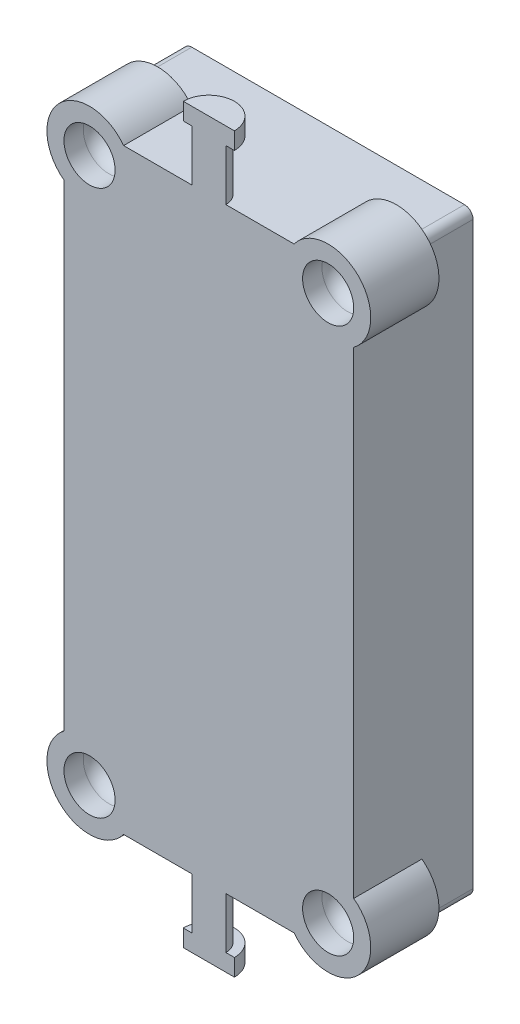
from build123d import *

# Parameters (mm, degrees)
SKETCH1_W           = 34
SKETCH1_H           = 70
BOSS_EXTRUDE1_DEPTH = 14
SKETCH2_W           = 30
SKETCH2_H           = 66
CUT_EXTRUDE1_DEPTH  = 12
SKETCH3_R           = 3
BOSS_EXTRUDE2_DEPTH = 12
SKETCH4_R           = 2
CUT_EXTRUDE2_DEPTH  = 80.069589603
CUT_EXTRUDE4_REACH  = 81.07
SKETCH6_R           = 2.5
SKETCH6_R_2         = 2
FILLET1_R           = 1
BOSS_EXTRUDE3_START = -8
SKETCH7_R           = 5
SKETCH7_R_2         = 3
BOSS_EXTRUDE3_DEPTH = 8
CUT_EXTRUDE7_START  = -4
SKETCH8_R           = 3
CUT_EXTRUDE7_DEPTH  = 4
BOSS_EXTRUDE4_DEPTH = 8
CUT_EXTRUDE8_START  = -8
CUT_EXTRUDE8_DEPTH  = 6
BOSS_EXTRUDE5_START = 8
BOSS_EXTRUDE5_DEPTH = 8
CUT_EXTRUDE9_START  = -2
CUT_EXTRUDE9_DEPTH  = 6
FILLET3_R           = 2


with BuildPart() as part:
    # Sketch1 → Boss-Extrude1 (new body)
    with BuildSketch(Plane.XY):
        with Locations((17, 35)):
            Rectangle(SKETCH1_W, SKETCH1_H)
    extrude(amount=BOSS_EXTRUDE1_DEPTH)

    # Sketch2 → Cut-Extrude1 (cut)
    with BuildSketch(Plane(origin=(0, 0, 0), x_dir=(-1, 0, 0), z_dir=(0, 0, -1))):
        with Locations((-17, 35)):
            Rectangle(SKETCH2_W, SKETCH2_H)
    extrude(amount=-CUT_EXTRUDE1_DEPTH, mode=Mode.SUBTRACT)

    # Sketch3 → Boss-Extrude2 (add)
    with BuildSketch(Plane(origin=(0, 0, 0), x_dir=(-1, 0, 0), z_dir=(0, 0, -1))):
        with Locations((-31, 67)):
            Circle(SKETCH3_R)
        with Locations((-3, 67)):
            Circle(SKETCH3_R)
        with Locations((-3, 3)):
            Circle(SKETCH3_R)
        with Locations((-31, 3)):
            Circle(SKETCH3_R)
    extrude(amount=-BOSS_EXTRUDE2_DEPTH)

    # Sketch4 → Cut-Extrude2 (cut, through all)
    with BuildSketch(Plane(origin=(0, 0, 0), x_dir=(-1, 0, 0), z_dir=(0, 0, -1))):
        with Locations((-3, 67)):
            Circle(SKETCH4_R)
        with Locations((-31, 67)):
            Circle(SKETCH4_R)
        with Locations((-3, 3)):
            Circle(SKETCH4_R)
        with Locations((-31, 3)):
            Circle(SKETCH4_R)
    extrude(amount=-CUT_EXTRUDE2_DEPTH, mode=Mode.SUBTRACT)

    # Sketch6 → Cut-Extrude4 (cut, up to next)
    with BuildSketch(Plane.XZ, mode=Mode.PRIVATE) as cut_extrude4_sk1:
        with Locations((9.5, 0)):
            Circle(SKETCH6_R)
    cut_extrude4_tool1 = extrude(cut_extrude4_sk1.sketch, amount=-CUT_EXTRUDE4_REACH, mode=Mode.PRIVATE) & part.part
    # Sketch6 → Cut-Extrude4 (cut, up to next)
    with BuildSketch(Plane.XZ, mode=Mode.PRIVATE) as cut_extrude4_sk2:
        with Locations((24.5, 0)):
            Circle(SKETCH6_R_2)
    cut_extrude4_tool2 = extrude(cut_extrude4_sk2.sketch, amount=-CUT_EXTRUDE4_REACH, mode=Mode.PRIVATE) & part.part
    add(cut_extrude4_tool1.solids().sort_by_distance((9.5, 0, 0))[0], mode=Mode.SUBTRACT)
    add(cut_extrude4_tool2.solids().sort_by_distance((24.5, 0, 0))[0], mode=Mode.SUBTRACT)

    # Fillet1
    fillet1_edges = [part.edges().sort_by_distance(p)[0] for p in [
        (0, 70, 7),
        (34, 70, 7),
        (34, 0, 7),
        (0, 0, 7),
    ]]
    fillet(fillet1_edges, radius=FILLET1_R)

    # Sketch7 → Boss-Extrude3 (add)
    # profile 1 of 4: a face of its own
    with BuildSketch(Plane.XY.offset(14).offset(BOSS_EXTRUDE3_START)):
        with Locations((31, 67)):
            Circle(SKETCH7_R)
        with Locations((31, 67)):
            Circle(SKETCH7_R_2, mode=Mode.SUBTRACT)
    # profile 2 of 4: a face of its own
    with BuildSketch(Plane.XY.offset(14).offset(BOSS_EXTRUDE3_START)):
        with Locations((3, 67)):
            Circle(SKETCH7_R)
        with Locations((3, 67)):
            Circle(SKETCH7_R_2, mode=Mode.SUBTRACT)
    # profile 3 of 4: a face of its own
    with BuildSketch(Plane.XY.offset(14).offset(BOSS_EXTRUDE3_START)):
        with Locations((31, 3)):
            Circle(SKETCH7_R)
        with Locations((31, 3)):
            Circle(SKETCH7_R_2, mode=Mode.SUBTRACT)
    # profile 4 of 4: a face of its own
    with BuildSketch(Plane.XY.offset(14).offset(BOSS_EXTRUDE3_START)):
        with Locations((3, 3)):
            Circle(SKETCH7_R)
        with Locations((3, 3)):
            Circle(SKETCH7_R_2, mode=Mode.SUBTRACT)
    extrude(amount=BOSS_EXTRUDE3_DEPTH)

    # Sketch8 → Cut-Extrude7 (cut)
    with BuildSketch(Plane.XY.offset(14).offset(CUT_EXTRUDE7_START)):
        with Locations((3, 3)):
            Circle(SKETCH8_R)
        with Locations((31, 3)):
            Circle(SKETCH8_R)
        with Locations((31, 67)):
            Circle(SKETCH8_R)
        with Locations((3, 67)):
            Circle(SKETCH8_R)
    extrude(amount=CUT_EXTRUDE7_DEPTH, mode=Mode.SUBTRACT)

    # Sketch9 → Boss-Extrude4 (add)
    with BuildSketch(Plane(origin=(0, 70, 0), x_dir=(1, 0, 0), z_dir=(0, 1, 0))):
        with BuildLine():
            Line((20, -14), (14, -14))
            ThreePointArc((14, -14), (17, -11), (20, -14))
        make_face()
    extrude(amount=BOSS_EXTRUDE4_DEPTH)

    # Sketch10 → Cut-Extrude8 (cut)
    with BuildSketch(Plane(origin=(0, 78, 0), x_dir=(1, 0, 0), z_dir=(0, 1, 0)).offset(CUT_EXTRUDE8_START)):
        with BuildLine():
            Line((19, -14), (20, -14))
            ThreePointArc((20, -14), (17, -11), (14, -14))
            Line((14, -14), (15, -14))
            ThreePointArc((15, -14), (17, -12), (19, -14))
        make_face()
    extrude(amount=CUT_EXTRUDE8_DEPTH, mode=Mode.SUBTRACT)

    # Sketch11 → Boss-Extrude5 (add)
    with BuildSketch(Plane.XZ.offset(BOSS_EXTRUDE5_START)):
        with BuildLine():
            Line((20, 14), (14, 14))
            ThreePointArc((14, 14), (17, 11), (20, 14))
        make_face()
    extrude(amount=-BOSS_EXTRUDE5_DEPTH)

    # Sketch12 → Cut-Extrude9 (cut)
    with BuildSketch(Plane.XZ.offset(8).offset(CUT_EXTRUDE9_START)):
        with BuildLine():
            Line((14, 14), (15, 14))
            ThreePointArc((15, 14), (17, 12), (19, 14))
            Line((19, 14), (20, 14))
            ThreePointArc((20, 14), (17, 11), (14, 14))
        make_face()
    extrude(amount=-CUT_EXTRUDE9_DEPTH, mode=Mode.SUBTRACT)

    # Fillet3
    # the kernel refuses this fillet: 2 mm, written as the material it adds along each edge
    with BuildSketch(Plane(origin=(3, 67, 10), x_dir=(1, 0, 0), z_dir=(0, -1, 0))) as fillet3_piece_1_section:
        with BuildLine():
            CenterArc((1, 1.732050808), FILLET3_R, 300, 60)
            Line((2, 0), (2.02, -0.034641016))
            ThreePointArc((2.02, -0.034641016), (2.5, -0.04), (3, -0.04))
            Line((3, -0.04), (3.04, 0))
            Line((3.04, 0), (3.04, 1.732050808))
            Line((3.04, 1.732050808), (3, 1.732050808))
        make_face()
    fillet3_piece_1 = revolve(axis=Axis((3, 67, 10), (0, 0, 1)), mode=Mode.PRIVATE)
    fillet3_piece_1 = fillet3_piece_1 - Plane(origin=(3, 67, 10.721085361), x_dir=(-1, 0, 0), z_dir=(0, 0, -1)) * Cylinder(2, 13, mode=Mode.PRIVATE)
    add(fillet3_piece_1)
    with BuildSketch(Plane(origin=(31, 67, 10), x_dir=(1, 0, 0), z_dir=(0, -1, 0))) as fillet3_piece_2_section:
        with BuildLine():
            CenterArc((1, 1.732050808), FILLET3_R, 300, 60)
            Line((2, 0), (2.02, -0.034641016))
            ThreePointArc((2.02, -0.034641016), (2.5, -0.04), (3, -0.04))
            Line((3, -0.04), (3.04, 0))
            Line((3.04, 0), (3.04, 1.732050808))
            Line((3.04, 1.732050808), (3, 1.732050808))
        make_face()
    fillet3_piece_2 = revolve(axis=Axis((31, 67, 10), (0, 0, 1)), mode=Mode.PRIVATE)
    fillet3_piece_2 = fillet3_piece_2 - Plane(origin=(31, 67, 10.721085361), x_dir=(-1, 0, 0), z_dir=(0, 0, -1)) * Cylinder(2, 13, mode=Mode.PRIVATE)
    add(fillet3_piece_2)
    with BuildSketch(Plane(origin=(31, 3, 10), x_dir=(1, 0, 0), z_dir=(0, -1, 0))) as fillet3_piece_3_section:
        with BuildLine():
            CenterArc((1, 1.732050808), FILLET3_R, 300, 60)
            Line((2, 0), (2.02, -0.034641016))
            ThreePointArc((2.02, -0.034641016), (2.5, -0.04), (3, -0.04))
            Line((3, -0.04), (3.04, 0))
            Line((3.04, 0), (3.04, 1.732050808))
            Line((3.04, 1.732050808), (3, 1.732050808))
        make_face()
    fillet3_piece_3 = revolve(axis=Axis((31, 3, 10), (0, 0, 1)), mode=Mode.PRIVATE)
    fillet3_piece_3 = fillet3_piece_3 - Plane(origin=(31, 3, 10.721085361), x_dir=(-1, 0, 0), z_dir=(0, 0, -1)) * Cylinder(2, 13, mode=Mode.PRIVATE)
    add(fillet3_piece_3)
    with BuildSketch(Plane(origin=(3, 3, 10), x_dir=(1, 0, 0), z_dir=(0, -1, 0))) as fillet3_piece_4_section:
        with BuildLine():
            CenterArc((1, 1.732050808), FILLET3_R, 300, 60)
            Line((2, 0), (2.02, -0.034641016))
            ThreePointArc((2.02, -0.034641016), (2.5, -0.04), (3, -0.04))
            Line((3, -0.04), (3.04, 0))
            Line((3.04, 0), (3.04, 1.732050808))
            Line((3.04, 1.732050808), (3, 1.732050808))
        make_face()
    fillet3_piece_4 = revolve(axis=Axis((3, 3, 10), (0, 0, 1)), mode=Mode.PRIVATE)
    fillet3_piece_4 = fillet3_piece_4 - Plane(origin=(3, 3, 10.721085361), x_dir=(-1, 0, 0), z_dir=(0, 0, -1)) * Cylinder(2, 13, mode=Mode.PRIVATE)
    add(fillet3_piece_4)


solid = part.part
